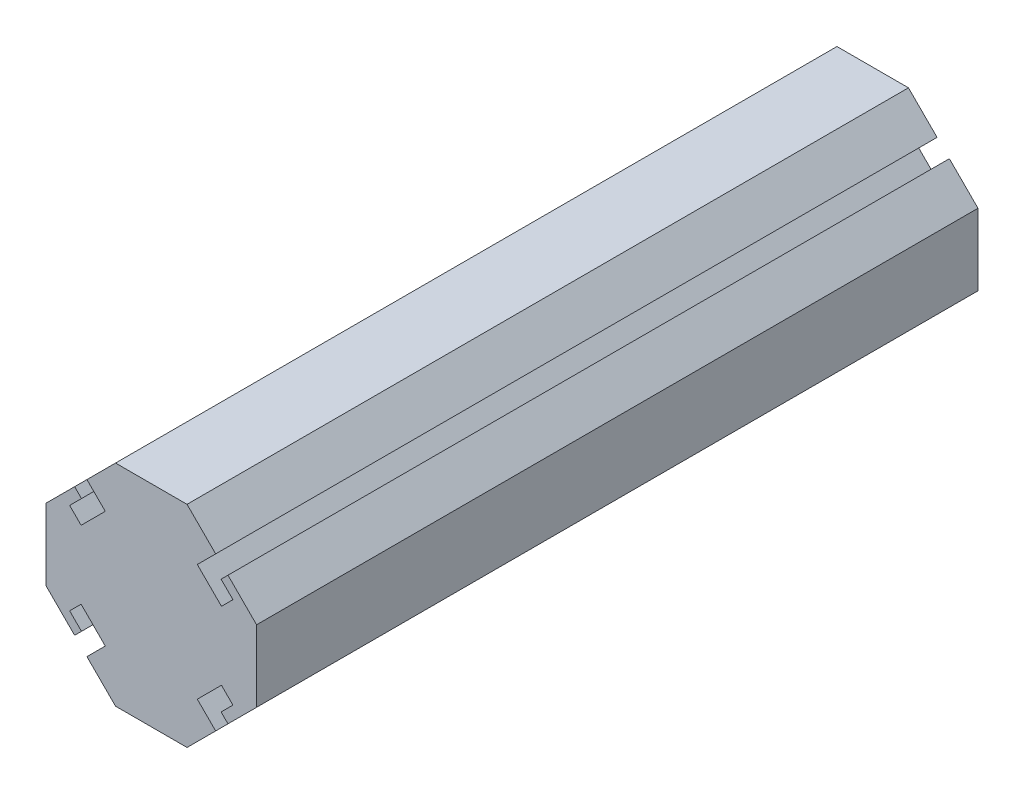
from build123d import *

# Parameters (mm, degrees)
EXTRUDE_1_DEPTH = 250


with BuildPart() as part:
    # Эскиз1 → Бобышка-Вытянуть1 (new body)
    with BuildSketch(Plane.XY):
        Polygon((-36.488448777, 12.389931009), (-36.488448777, -12.389931009), (-26.570600857, -22.307778929), (-24.189396736, -19.926574807), (-28.294934461, -15.821037081), (-24.31711122, -11.843213839), (-15.948751565, -20.211573494), (-22.307778929, -26.570600857), (-12.389931009, -36.488448777), (12.389931009, -36.488448777), (22.307778929, -26.570600857), (15.948751565, -20.211573494), (24.31711122, -11.843213839), (28.294934461, -15.821037081), (24.189396736, -19.926574807), (26.570600857, -22.307778929), (36.488448777, -12.389931009), (36.488448777, 12.389931009), (26.570600857, 22.307778929), (24.189396736, 19.926574807), (28.294934461, 15.821037081), (24.31711122, 11.843213839), (15.948751565, 20.211573494), (22.307778929, 26.570600857), (12.389931009, 36.488448777), (-12.389931009, 36.488448777), (-22.307778929, 26.570600857), (-15.948751565, 20.211573494), (-24.31711122, 11.843213839), (-28.294934461, 15.821037081), (-24.189396736, 19.926574807), (-26.570600857, 22.307778929), align=None)
    extrude(amount=-EXTRUDE_1_DEPTH)


solid = part.part
